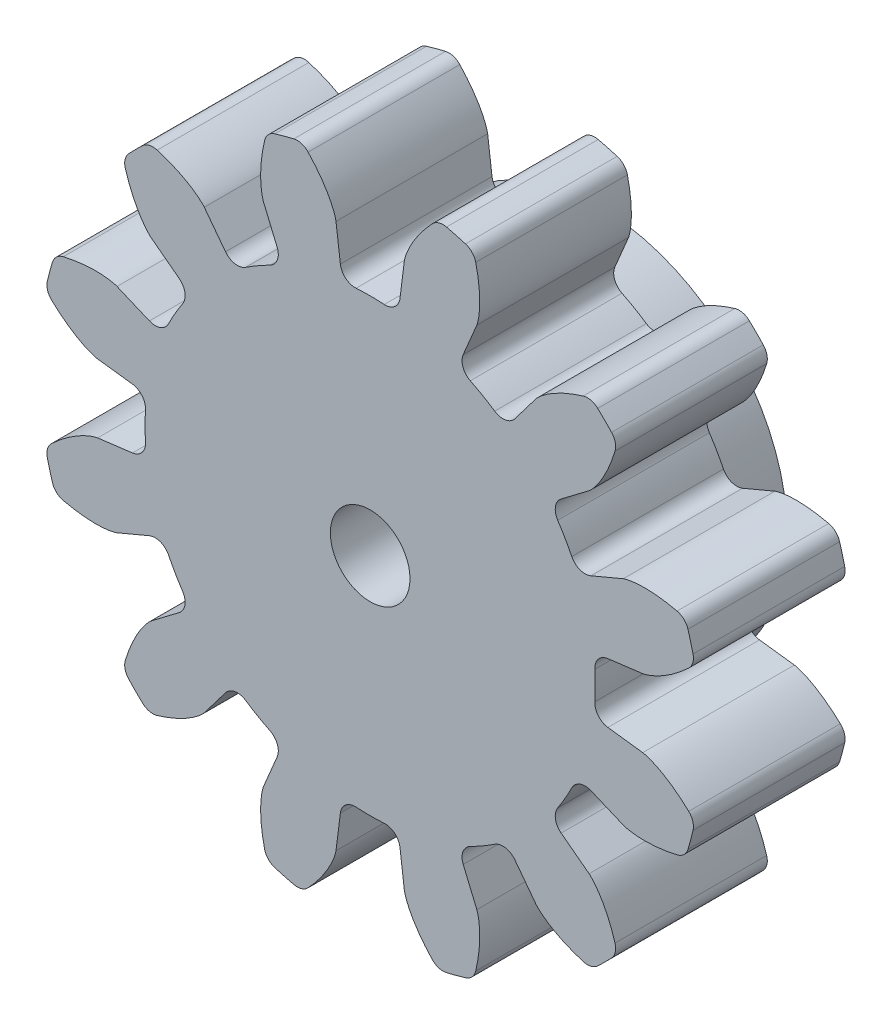
from build123d import *

# Parameters (mm, degrees)
SKETCH1_R                = 8.75
BOSS_EXTRUDE1_DEPTH      = 4
CUT_EXTRUDE1_DEPTH       = 14.004806804
FILLET1_R                = 0.393380952
CIRPATTERN1_COUNT        = 12
FILLET1_OF_CIRPATTERN1_R = 0.393380952
SKETCH4_R                = 5
BOSS_EXTRUDE2_DEPTH      = 2
CUT_EXTRUDE2_DEPTH       = 2
CUT_EXTRUDE2_DEPTH_BACK  = 2
SKETCH3_R                = 2.65
SKETCH5_R                = 1.05
CUT_EXTRUDE3_DEPTH       = 13.703353196


with BuildPart() as part:
    # Sketch1 → Boss-Extrude1 (new body)
    with BuildSketch(Plane.XY):
        Circle(SKETCH1_R)
    extrude(amount=BOSS_EXTRUDE1_DEPTH)

    # Sketch2 → Cut-Extrude1 (cut, through all)
    with BuildSketch(Plane.XY.offset(4)):
        with BuildLine():
            Line((7.188145812, 0.901401282), (5.891358611, 0.738782761))
            ThreePointArc((5.891358611, 0.738782761), (5.9375, 0), (5.891358611, -0.738782761))
            Line((5.891358611, -0.738782761), (7.188145812, -0.901401282))
            add(Edge.make_bspline(
                [(7.188145812, -0.901401282), (7.190579777, -0.901741998), (7.197391181, -0.902805625), (7.210205817, -0.905242636), (7.23101261, -0.909822185), (7.257360553, -0.916541261), (7.291207198, -0.926236485), (7.330791133, -0.938952588), (7.373965969, -0.954277408), (7.420559753, -0.97239948), (7.466688999, -0.991754376), (7.512356189, -1.012242451), (7.557520927, -1.033712622), (7.611823547, -1.060965521), (7.676359788, -1.095371492), (7.750898718, -1.138080016), (7.834342106, -1.189443527), (7.918143121, -1.244883144), (7.999559346, -1.301965156), (8.080551907, -1.362507526), (8.158013357, -1.423116155), (8.237093534, -1.488957752), (8.309392832, -1.551206431), (8.388794945, -1.624092265), (8.452412257, -1.683834922), (8.516747156, -1.748135323), (8.54785322, -1.779810517), (8.563662607, -1.796157773)],
                knots=[0, 0, 0, 0, 0, 0.005376749, 0.015083688, 0.02853182, 0.04661014, 0.064854849, 0.092110525, 0.119476176, 0.146842496, 0.174208854, 0.201574956, 0.228941013, 0.256307345, 0.307035032, 0.361767352, 0.416499661, 0.471231937, 0.525964282, 0.580696616, 0.635428982, 0.690161387, 0.744893688, 0.799626082, 0.854358408, 0.909090915, 0.909090915, 0.909090915, 0.909090915, 0.909090915], degree=4))
            ThreePointArc((8.563662607, -1.796157773), (8.703290981, -0.902898717), (8.75, 0))
            ThreePointArc((8.75, 0), (8.703290981, 0.902898717), (8.563662607, 1.796157773))
            add(Edge.make_bspline(
                [(7.188145812, 0.901401282), (7.190579777, 0.901741998), (7.197391181, 0.902805625), (7.210205817, 0.905242636), (7.23101261, 0.909822185), (7.257360553, 0.916541261), (7.291207198, 0.926236485), (7.330791133, 0.938952588), (7.373965969, 0.954277408), (7.420559753, 0.97239948), (7.466688999, 0.991754376), (7.512356189, 1.012242451), (7.557520927, 1.033712622), (7.611823547, 1.060965521), (7.676359788, 1.095371492), (7.750898718, 1.138080016), (7.834342106, 1.189443527), (7.918143121, 1.244883144), (7.999559346, 1.301965156), (8.080551907, 1.362507526), (8.158013357, 1.423116155), (8.237093534, 1.488957752), (8.309392832, 1.551206431), (8.388794945, 1.624092265), (8.452412257, 1.683834922), (8.516747156, 1.748135323), (8.54785322, 1.779810517), (8.563662607, 1.796157773)],
                knots=[0, 0, 0, 0, 0, 0.005376749, 0.015083688, 0.02853182, 0.04661014, 0.064854849, 0.092110525, 0.119476176, 0.146842496, 0.174208854, 0.201574956, 0.228941013, 0.256307345, 0.307035032, 0.361767352, 0.416499661, 0.471231937, 0.525964282, 0.580696616, 0.635428982, 0.690161387, 0.744893688, 0.799626082, 0.854358408, 0.909090915, 0.909090915, 0.909090915, 0.909090915, 0.909090915], degree=4))
        make_face()
    cut_extrude1 = extrude(amount=-CUT_EXTRUDE1_DEPTH, mode=Mode.SUBTRACT)

    # Fillet1
    fillet1_edges = [part.edges().sort_by_distance(p)[0] for p in [
        (5.891358611, -0.738782761, 2),
        (5.891358611, 0.738782761, 2),
        (8.563662607, -1.796157773, 2),
        (8.563662607, 1.796157773, 2),
    ]]
    fillet(fillet1_edges, radius=FILLET1_R)

    # CirPattern1: Cut-Extrude1 ×12 about axis
    cirpattern1_axis = Axis((0, 0, 0), (0, 0, 1))
    for i in range(1, CIRPATTERN1_COUNT):
        add(cut_extrude1.rotate(cirpattern1_axis, i * 360 / CIRPATTERN1_COUNT), mode=Mode.SUBTRACT)

    # Fillet1 of CirPattern1
    fillet1_of_cirpattern1_edges = [part.edges().sort_by_distance(p)[0] for p in [
        (5.4714576, 2.305874667, 2),
        (4.73267484, 3.585483944, 2),
        (8.314428254, 2.726313043, 2),
        (6.518270481, 5.837349564, 2),
        (3.585483944, 4.73267484, 2),
        (2.305874667, 5.4714576, 2),
        (5.837349564, 6.518270481, 2),
        (2.726313043, 8.314428254, 2),
        (0.738782761, 5.891358611, 2),
        (-0.738782761, 5.891358611, 2),
        (1.796157773, 8.563662607, 2),
        (-1.796157773, 8.563662607, 2),
        (-2.305874667, 5.4714576, 2),
        (-3.585483944, 4.73267484, 2),
        (-2.726313043, 8.314428254, 2),
        (-5.837349564, 6.518270481, 2),
        (-4.73267484, 3.585483944, 2),
        (-5.4714576, 2.305874667, 2),
        (-6.518270481, 5.837349564, 2),
        (-8.314428254, 2.726313043, 2),
        (-5.891358611, 0.738782761, 2),
        (-5.891358611, -0.738782761, 2),
        (-8.563662607, 1.796157773, 2),
        (-8.563662607, -1.796157773, 2),
        (-5.4714576, -2.305874667, 2),
        (-4.73267484, -3.585483944, 2),
        (-8.314428254, -2.726313043, 2),
        (-6.518270481, -5.837349564, 2),
        (-3.585483944, -4.73267484, 2),
        (-2.305874667, -5.4714576, 2),
        (-5.837349564, -6.518270481, 2),
        (-2.726313043, -8.314428254, 2),
        (-0.738782761, -5.891358611, 2),
        (0.738782761, -5.891358611, 2),
        (-1.796157773, -8.563662607, 2),
        (1.796157773, -8.563662607, 2),
        (2.305874667, -5.4714576, 2),
        (3.585483944, -4.73267484, 2),
        (2.726313043, -8.314428254, 2),
        (5.837349564, -6.518270481, 2),
        (4.73267484, -3.585483944, 2),
        (5.4714576, -2.305874667, 2),
        (6.518270481, -5.837349564, 2),
        (8.314428254, -2.726313043, 2),
    ]]
    fillet(fillet1_of_cirpattern1_edges, radius=FILLET1_OF_CIRPATTERN1_R)

    # Sketch4 → Boss-Extrude2 (add)
    with BuildSketch(Plane.XY):
        Circle(SKETCH4_R)
    extrude(amount=-BOSS_EXTRUDE2_DEPTH)

    # Sketch3 → Cut-Extrude2 (cut, two sides: drawn at the far end of the back side and taken through both)
    with BuildSketch(Plane.XY.offset(-CUT_EXTRUDE2_DEPTH_BACK)):
        Circle(SKETCH3_R)
    extrude(amount=CUT_EXTRUDE2_DEPTH + CUT_EXTRUDE2_DEPTH_BACK, mode=Mode.SUBTRACT)

    # Sketch5 → Cut-Extrude3 (cut, through all)
    with BuildSketch(Plane.XY):
        Circle(SKETCH5_R)
    extrude(amount=CUT_EXTRUDE3_DEPTH, mode=Mode.SUBTRACT)


solid = part.part
